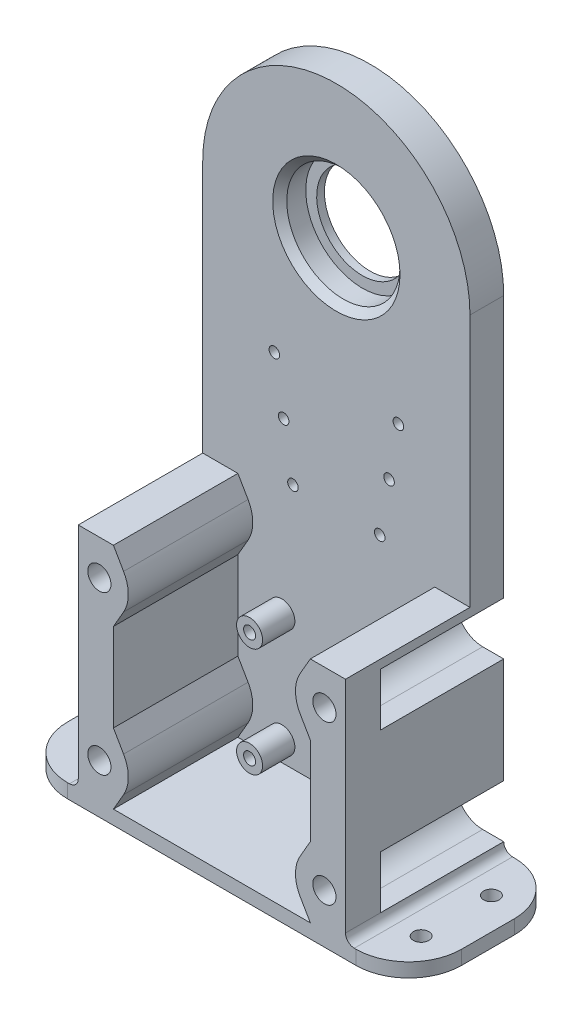
from build123d import *

# Parameters (mm, degrees)
SKIZZE1_W                        = 45
SKIZZE1_H                        = 65
AUFSATZ_LINEAR_AUSTRAGEN1_DEPTH  = 38
SKIZZE2_OUTSIDE_W                = 99.932
SKIZZE2_OUTSIDE_H                = 88.932
SCHNITT_LINEAR_AUSTRAGEN1_DEPTH  = 35.4
SCHNITT_LINEAR_AUSTRAGEN2_DEPTH  = 35
SKIZZE4_R                        = 3.3
SCHNITT_LINEAR_AUSTRAGEN3_DEPTH  = 84.030115019
AUFSATZ_LINEAR_AUSTRAGEN2_DEPTH  = 9.6
SKIZZE6_R                        = 16.1
SCHNITT_LINEAR_AUSTRAGEN4_DEPTH  = 7.4
SKIZZE8_R                        = 13
SCHNITT_LINEAR_AUSTRAGEN5_DEPTH  = 185.645606501
SKIZZE9_R                        = 1.5
SCHNITT_LINEAR_AUSTRAGEN6_DEPTH  = 185.645606501
SKIZZE12_W                       = 76
SKIZZE12_H                       = 45
AUFSATZ_LINEAR_AUSTRAGEN4_DEPTH  = 4
SKIZZE10_W                       = 45
SKIZZE10_H                       = 4
AUFSATZ_LINEAR_AUSTRAGEN3_DEPTH  = 18
VERRUNDUNG1_R                    = 15
SKIZZE11_R                       = 2.2
SCHNITT_LINEAR_AUSTRAGEN7_DEPTH  = 183.752564961
VERRUNDUNG1_OF_SPIEGELN1_R       = 15
SKIZZE13_R                       = 3.7
SKIZZE13_R_2                     = 1.7
AUFSATZ_LINEAR_AUSTRAGEN5_DEPTH  = 9.178687268
SCHNITT_LINEAR_START             = -9.6
SKIZZE14_R                       = 1.7
SCHNITT_LINEAR_AUSTRAGEN8_DEPTH  = 9.6
SKIZZE15_R                       = 5
SCHNITT_LINEAR_AUSTRAGEN9_DEPTH  = 9.6
SKIZZE19_R                       = 3.25
SCHNITT_LINEAR_AUSTRAGEN11_DEPTH = 3.4
VERRUNDUNG2_R                    = 10
FASE2_SIZE                       = 2
VERRUNDUNG3_R                    = 2.5


with BuildPart() as part:
    # Skizze1 → Aufsatz-Linear austragen1 (new, symmetric)
    with BuildSketch(Plane(origin=(0, 0, 0), x_dir=(0, 0, -1), z_dir=(1, 0, 0))):
        with Locations((0, 32.5)):
            Rectangle(SKIZZE1_W, SKIZZE1_H)
    extrude(amount=AUFSATZ_LINEAR_AUSTRAGEN1_DEPTH, both=True)

    # Skizze2 outside → Schnitt-Linear austragen1 (cut)
    with BuildSketch(Plane.XY.offset(22.5)):
        with Locations((0, 32.5)):
            Rectangle(SKIZZE2_OUTSIDE_W, SKIZZE2_OUTSIDE_H)
        Polygon((-38, 0), (-28, 0), (-22.226497308, 10), (-28, 20), (-28, 45), (-22.226497308, 55), (-28, 65), (-38, 65), align=None, mode=Mode.SUBTRACT)
        Polygon((38, 65), (38, 0), (28, 0), (22.226497308, 10), (28, 20), (28, 45), (22.226497308, 55), (28, 65), align=None, mode=Mode.SUBTRACT)
    extrude(amount=-SCHNITT_LINEAR_AUSTRAGEN1_DEPTH, mode=Mode.SUBTRACT)

    # Skizze3 → Schnitt-Linear austragen2 (cut)
    with BuildSketch(Plane(origin=(0, 0, -22.5), x_dir=(-1, 0, 0), z_dir=(0, 0, -1))):
        with BuildLine():
            Line((-32, 17.5), (-38, 17.5))
            Line((-38, 17.5), (-38, 2.5))
            Line((-38, 2.5), (-32, 2.5))
            ThreePointArc((-32, 2.5), (-24.5, 10), (-32, 17.5))
        make_face()
        with BuildLine():
            Line((38, 17.5), (38, 2.5))
            Line((38, 2.5), (32, 2.5))
            ThreePointArc((32, 2.5), (24.5, 10), (32, 17.5))
            Line((32, 17.5), (38, 17.5))
        make_face()
        with BuildLine():
            Line((32, 47.5), (38, 47.5))
            Line((38, 47.5), (38, 62.5))
            Line((38, 62.5), (32, 62.5))
            ThreePointArc((32, 62.5), (24.5, 55), (32, 47.5))
        make_face()
        with BuildLine():
            Line((-38, 47.5), (-38, 62.5))
            Line((-38, 62.5), (-32, 62.5))
            ThreePointArc((-32, 62.5), (-24.5, 55), (-32, 47.5))
            Line((-32, 47.5), (-38, 47.5))
        make_face()
    extrude(amount=-SCHNITT_LINEAR_AUSTRAGEN2_DEPTH, mode=Mode.SUBTRACT)

    # Skizze4 → Schnitt-Linear austragen3 (cut, through all)
    with BuildSketch(Plane(origin=(0, 0, 12.5), x_dir=(-1, 0, 0), z_dir=(0, 0, -1))):
        with Locations(Location((32, 10, 0), (0, 0, 90))):
            Circle(SKIZZE4_R)
        with Locations(Location((-32, 10, 0), (0, 0, 270))):
            Circle(SKIZZE4_R)
        with Locations(Location((-32, 55, 0), (0, 0, 90))):
            Circle(SKIZZE4_R)
        with Locations(Location((32, 55, 0), (0, 0, 270))):
            Circle(SKIZZE4_R)
    extrude(amount=-SCHNITT_LINEAR_AUSTRAGEN3_DEPTH, mode=Mode.SUBTRACT)

    # Skizze5 → Aufsatz-Linear austragen2 (add)
    with BuildSketch(Plane.XY.offset(-12.9)):
        with BuildLine():
            Line((-38, 65), (38, 65))
            Line((38, 65), (38, 137))
            ThreePointArc((38, 137), (0, 175), (-38, 137))
            Line((-38, 137), (-38, 65))
        make_face()
    extrude(amount=-AUFSATZ_LINEAR_AUSTRAGEN2_DEPTH)

    # Skizze6 → Schnitt-Linear austragen4 (cut)
    with BuildSketch(Plane.XY.offset(-12.9)):
        with Locations((0, 137)):
            Circle(SKIZZE6_R)
    extrude(amount=-SCHNITT_LINEAR_AUSTRAGEN4_DEPTH, mode=Mode.SUBTRACT)

    # Skizze8 → Schnitt-Linear austragen5 (cut, through all)
    with BuildSketch(Plane(origin=(0, 0, -22.5), x_dir=(-1, 0, 0), z_dir=(0, 0, -1))):
        with Locations(Location((0, 137, 0), (0, 0, 90))):
            Circle(SKIZZE8_R)
    extrude(amount=-SCHNITT_LINEAR_AUSTRAGEN5_DEPTH, mode=Mode.SUBTRACT)

    # Skizze9 → Schnitt-Linear austragen6 (cut, through all)
    with BuildSketch(Plane(origin=(0, 0, -22.5), x_dir=(-1, 0, 0), z_dir=(0, 0, -1))):
        with Locations(Location((12.34288865, 70, 0), (0, 0, 90))):
            Circle(SKIZZE9_R)
        with Locations(Location((14.98779336, 85, 0), (0, 0, 90))):
            Circle(SKIZZE9_R)
        with Locations(Location((17.632698071, 100, 0), (0, 0, 90))):
            Circle(SKIZZE9_R)
        with Locations(Location((-12.34288865, 70, 0), (0, 0, 180))):
            Circle(SKIZZE9_R)
        with Locations(Location((-17.632698071, 100, 0), (0, 0, 180))):
            Circle(SKIZZE9_R)
        with Locations(Location((-14.98779336, 85, 0), (0, 0, 180))):
            Circle(SKIZZE9_R)
    extrude(amount=-SCHNITT_LINEAR_AUSTRAGEN6_DEPTH, mode=Mode.SUBTRACT)

    # Skizze12 → Aufsatz-Linear austragen4 (add)
    with BuildSketch(Plane.XZ):
        Rectangle(SKIZZE12_W, SKIZZE12_H)
    extrude(amount=AUFSATZ_LINEAR_AUSTRAGEN4_DEPTH)

    # Skizze10 → Aufsatz-Linear austragen3 (add)
    with BuildSketch(Plane(origin=(38, 0, 0), x_dir=(0, 0, -1), z_dir=(1, 0, 0))):
        with Locations((0, -2)):
            Rectangle(SKIZZE10_W, SKIZZE10_H)
    aufsatz_linear_austragen3 = extrude(amount=AUFSATZ_LINEAR_AUSTRAGEN3_DEPTH)

    # Verrundung1
    verrundung1_edges = [part.edges().sort_by_distance(p)[0] for p in [
        (56, -2, -22.5),
        (56, -2, 22.5),
    ]]
    fillet(verrundung1_edges, radius=VERRUNDUNG1_R)

    # Skizze11 → Schnitt-Linear austragen7 (cut, through all)
    with BuildSketch(Plane(origin=(0, 2.5, 0), x_dir=(1, 0, 0), z_dir=(0, 1, 0))):
        with Locations(Location((47, 10, 0), (0, 0, 180))):
            Circle(SKIZZE11_R)
        with Locations(Location((47, -10, 0), (0, 0, 90))):
            Circle(SKIZZE11_R)
    schnitt_linear_austragen7 = extrude(amount=-SCHNITT_LINEAR_AUSTRAGEN7_DEPTH, mode=Mode.SUBTRACT)

    # Spiegeln1: Aufsatz-Linear austragen3, Schnitt-Linear austragen7 across plane
    add(aufsatz_linear_austragen3.mirror(Plane(origin=(0, 0, 0), x_dir=(0, 0, 1), z_dir=(1, 0, 0))))
    add(schnitt_linear_austragen7.mirror(Plane(origin=(0, 0, 0), x_dir=(0, 0, 1), z_dir=(1, 0, 0))), mode=Mode.SUBTRACT)

    # Verrundung1 of Spiegeln1
    verrundung1_of_spiegeln1_edges = [part.edges().sort_by_distance(p)[0] for p in [
        (-56, -2, -22.5),
        (-56, -2, 22.5),
    ]]
    fillet(verrundung1_of_spiegeln1_edges, radius=VERRUNDUNG1_OF_SPIEGELN1_R)

    # Skizze13 → Aufsatz-Linear austragen5 (add)
    # profile 1 of 4: a face of its own
    with BuildSketch(Plane.XY.offset(-12.9)):
        with Locations(Location((-15.5, 36.65, 0), (0, 0, 180))):
            Circle(SKIZZE13_R)
        with Locations(Location((-15.5, 36.65, 0), (0, 0, 180))):
            Circle(SKIZZE13_R_2, mode=Mode.SUBTRACT)
    # profile 2 of 4: a face of its own
    with BuildSketch(Plane.XY.offset(-12.9)):
        with Locations(Location((15.5, 36.65, 0), (0, 0, 180))):
            Circle(SKIZZE13_R)
        with Locations(Location((15.5, 36.65, 0), (0, 0, 180))):
            Circle(SKIZZE13_R_2, mode=Mode.SUBTRACT)
    # profile 3 of 4: a face of its own
    with BuildSketch(Plane.XY.offset(-12.9)):
        with Locations(Location((15.5, 5.65, 0), (0, 0, 180))):
            Circle(SKIZZE13_R)
        with Locations(Location((15.5, 5.65, 0), (0, 0, 180))):
            Circle(SKIZZE13_R_2, mode=Mode.SUBTRACT)
    # profile 4 of 4: a face of its own
    with BuildSketch(Plane.XY.offset(-12.9)):
        with Locations(Location((-15.5, 5.65, 0), (0, 0, 180))):
            Circle(SKIZZE13_R)
        with Locations(Location((-15.5, 5.65, 0), (0, 0, 180))):
            Circle(SKIZZE13_R_2, mode=Mode.SUBTRACT)
    extrude(amount=AUFSATZ_LINEAR_AUSTRAGEN5_DEPTH)

    # Skizze14 → Schnitt-Linear austragen8 (cut)
    with BuildSketch(Plane.XY.offset(-12.9).offset(SCHNITT_LINEAR_START)):
        with Locations(Location((-15.5, 5.65, 0), (0, 0, 180))):
            Circle(SKIZZE14_R)
        with Locations(Location((15.5, 5.65, 0), (0, 0, 180))):
            Circle(SKIZZE14_R)
        with Locations(Location((15.5, 36.65, 0), (0, 0, 180))):
            Circle(SKIZZE14_R)
        with Locations(Location((-15.5, 36.65, 0), (0, 0, 180))):
            Circle(SKIZZE14_R)
    extrude(amount=SCHNITT_LINEAR_AUSTRAGEN8_DEPTH, mode=Mode.SUBTRACT)

    # Skizze15 → Schnitt-Linear austragen9 (cut)
    with BuildSketch(Plane(origin=(0, 0, -22.5), x_dir=(-1, 0, 0), z_dir=(0, 0, -1))):
        with Locations(Location((0, 21.15, 0), (0, 0, 90))):
            Circle(SKIZZE15_R)
    extrude(amount=-SCHNITT_LINEAR_AUSTRAGEN9_DEPTH, mode=Mode.SUBTRACT)

    # Skizze19 → Schnitt-Linear austragen11 (cut)
    with BuildSketch(Plane(origin=(0, 0, -22.5), x_dir=(-1, 0, 0), z_dir=(0, 0, -1))):
        with Locations(Location((-15.5, 36.65, 0), (0, 0, 90))):
            Circle(SKIZZE19_R)
        with Locations(Location((15.5, 36.65, 0), (0, 0, 90))):
            Circle(SKIZZE19_R)
        with Locations(Location((15.5, 5.65, 0), (0, 0, 90))):
            Circle(SKIZZE19_R)
        with Locations(Location((-15.5, 5.65, 0), (0, 0, 90))):
            Circle(SKIZZE19_R)
    extrude(amount=-SCHNITT_LINEAR_AUSTRAGEN11_DEPTH, mode=Mode.SUBTRACT)

    # Verrundung2
    verrundung2_edges = [part.edges().sort_by_distance(p)[0] for p in [
        (-22.226497308, 55, 4.8),
        (-22.226497308, 10, 4.8),
        (22.226497308, 55, 4.8),
        (22.226497308, 10, 4.8),
    ]]
    fillet(verrundung2_edges, radius=VERRUNDUNG2_R)

    # Fase2
    fase2_edges = [part.edges().sort_by_distance(p)[0] for p in [
        (-16.1, 137, -12.9),
    ]]
    chamfer(fase2_edges, length=FASE2_SIZE)

    # Verrundung3
    verrundung3_edges = [part.edges().sort_by_distance(p)[0] for p in [
        (-38, 0, 0),
        (38, 0, 0),
    ]]
    fillet(verrundung3_edges, radius=VERRUNDUNG3_R - 0.0001)  # a hair under: the kernel refuses the full size


solid = part.part
